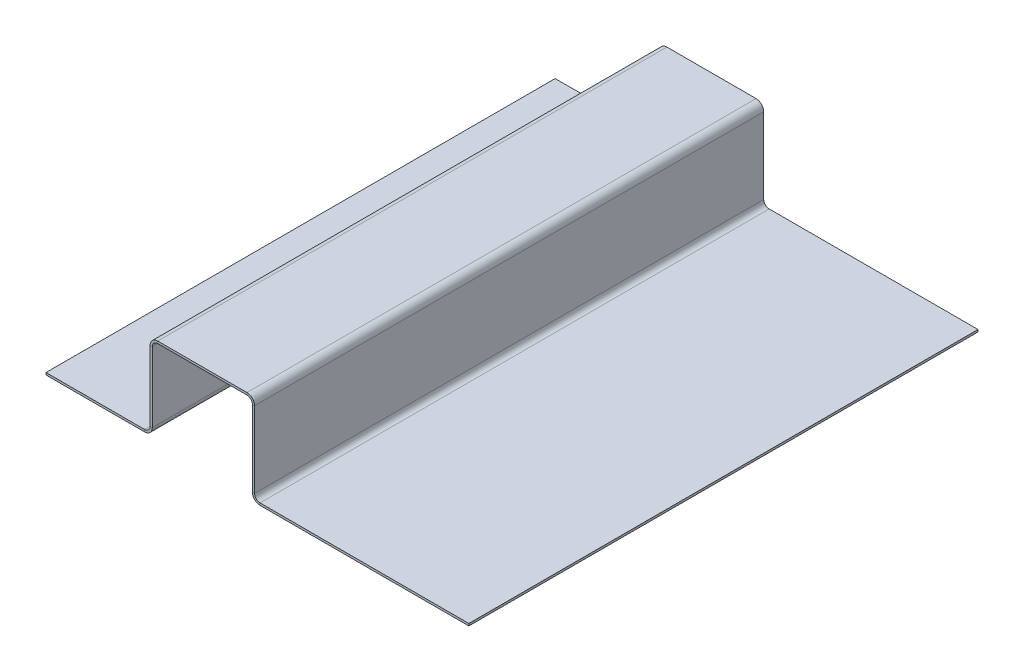
from build123d import *

# Parameters (mm, degrees)
SM_BASE_FLANGE_1_DEPTH = 234


# Sheet-metal steps are written as plain solids
with BuildPart() as part:
    # Sketch 1 → 基体-法兰1 (new body)
    with BuildSketch(Plane.XY):
        with BuildLine():
            Line((-60.278701471, 2.716046142), (-14.941243618, 2.716046142))
            ThreePointArc((-14.941243618, 2.716046142), (-13.173476665, 3.448279189), (-12.441243618, 5.216046142))
            Line((-12.441243618, 5.216046142), (-12.441243618, 37.415920911))
            ThreePointArc((-12.441243618, 37.415920911), (-11.416117352, 39.890794646), (-8.941243618, 40.915920911))
            Line((-8.941243618, 40.915920911), (32.071443019, 40.915920911))
            ThreePointArc((32.071443019, 40.915920911), (34.546316754, 39.890794646), (35.571443019, 37.415920911))
            Line((35.571443019, 37.415920911), (35.571443019, 2.5))
            ThreePointArc((35.571443019, 2.5), (36.303676066, 0.732233047), (38.071443019, 0))
            Line((38.071443019, 0), (134.05001926, 0))
            Line((134.05001926, 0), (134.05001926, -1))
            Line((134.05001926, -1), (38.071443019, -1))
            ThreePointArc((38.071443019, -1), (35.596569285, 0.025126266), (34.571443019, 2.5))
            Line((34.571443019, 2.5), (34.571443019, 37.415920911))
            ThreePointArc((34.571443019, 37.415920911), (33.839209972, 39.183687864), (32.071443019, 39.915920911))
            Line((32.071443019, 39.915920911), (-8.941243618, 39.915920911))
            ThreePointArc((-8.941243618, 39.915920911), (-10.709010571, 39.183687864), (-11.441243618, 37.415920911))
            Line((-11.441243618, 37.415920911), (-11.441243618, 5.216046142))
            ThreePointArc((-11.441243618, 5.216046142), (-12.466369883, 2.741172408), (-14.941243618, 1.716046142))
            Line((-14.941243618, 1.716046142), (-60.278701471, 1.716046142))
            Line((-60.278701471, 1.716046142), (-60.278701471, 2.716046142))
        make_face()
    extrude(amount=SM_BASE_FLANGE_1_DEPTH)


solid = part.part
